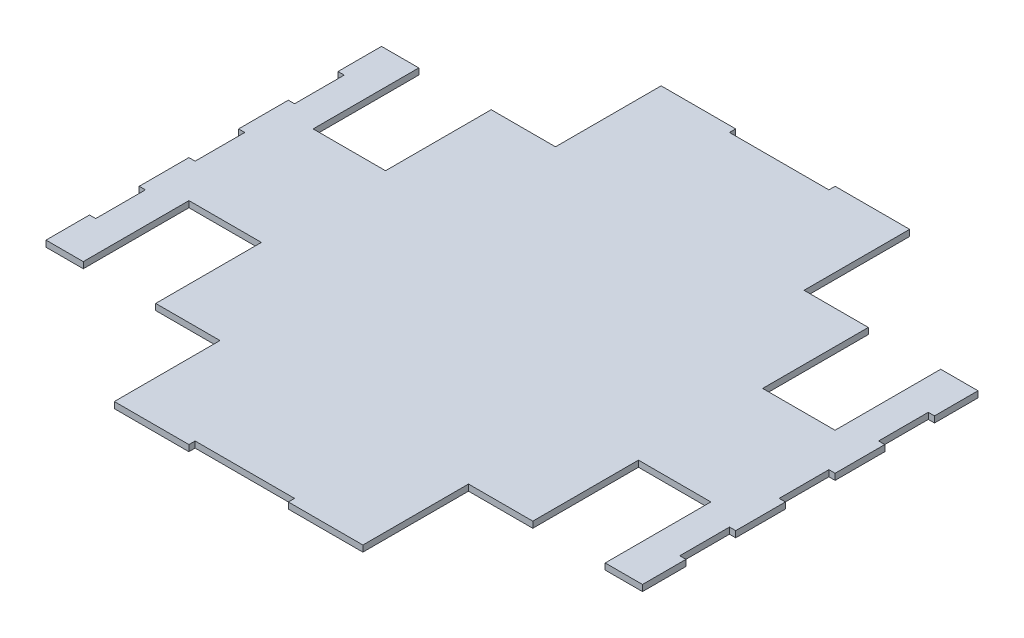
from build123d import *

# Parameters (mm, degrees)
BOSS_EXTRUDE1_DEPTH = 3.175


with BuildPart() as part:
    # Sketch1 → Boss-Extrude1 (new body)
    with BuildSketch(Plane(origin=(0, 0, 0), x_dir=(1, 0, 0), z_dir=(0, 1, 0))):
        Polygon((152.4, 63.5), (152.4, 85.725), (133.35, 85.725), (133.35, 31.725), (96.35, 31.725), (96.35, 85.725), (63.5, 85.725), (63.5, 139.7), (25.4, 139.7), (25.4, 136.525), (-25.4, 136.525), (-25.4, 139.7), (-63.5, 139.7), (-63.5, 85.725), (-96.35, 85.725), (-96.35, 31.725), (-133.35, 31.725), (-133.35, 85.725), (-152.4, 85.725), (-152.4, 63.5), (-149.225, 63.5), (-149.225, 38.1), (-152.4, 38.1), (-152.4, 12.7), (-149.225, 12.7), (-149.225, -12.7), (-152.4, -12.7), (-152.4, -38.1), (-149.225, -38.1), (-149.225, -63.5), (-152.4, -63.5), (-152.4, -85.725), (-133.35, -85.725), (-133.35, -31.725), (-96.35, -31.725), (-96.35, -85.725), (-63.5, -85.725), (-63.5, -139.7), (-25.4, -139.7), (-25.4, -136.525), (25.4, -136.525), (25.4, -139.7), (63.5, -139.7), (63.5, -85.725), (96.35, -85.725), (96.35, -31.725), (133.35, -31.725), (133.35, -85.725), (152.4, -85.725), (152.4, -63.5), (149.225, -63.5), (149.225, -38.1), (152.4, -38.1), (152.4, -12.7), (149.225, -12.7), (149.225, 12.7), (152.4, 12.7), (152.4, 38.1), (149.225, 38.1), (149.225, 63.5), align=None)
    extrude(amount=BOSS_EXTRUDE1_DEPTH)


solid = part.part
